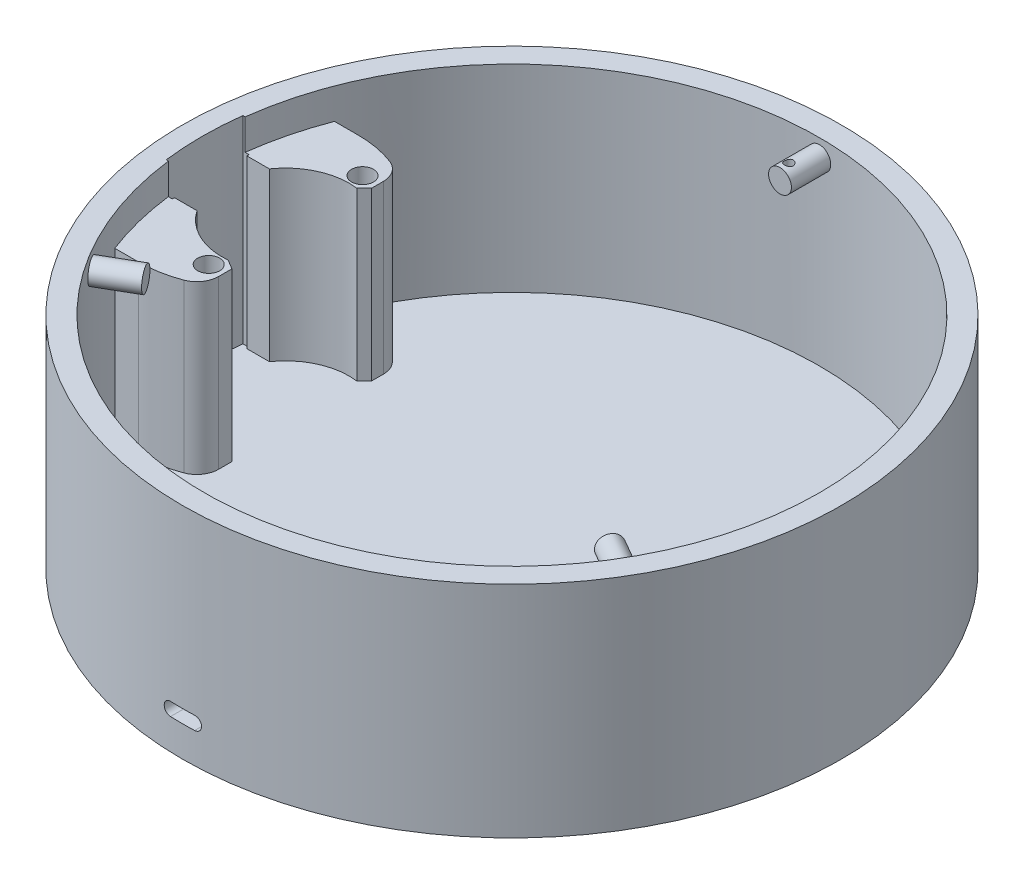
from build123d import *

# Parameters (mm, degrees)
SKETCH1_R               = 75
BOSS_EXTRUDE1_DEPTH     = 50
SHELL1_T                = -5
CUT_EXTRUDE1_REACH      = 177
CUT_EXTRUDE1_END_RADIUS = 70
BOSS_EXTRUDE2_DEPTH     = 10
CIRPATTERN1_COUNT       = 3
BOSS_EXTRUDE6_DEPTH     = 38
SKETCH13_R              = 2.5
CUT_EXTRUDE7_DEPTH      = 5
SKETCH14_R              = 2.5
CUT_EXTRUDE8_DEPTH      = 5
CUT_EXTRUDE9_START      = -38
CUT_EXTRUDE9_DEPTH      = 38
CHAMFER1_SIZE           = 2
CHAMFER1_SIZE_2         = 1.650424
FILLET1_R               = 5
CUT_EXTRUDE10_DEPTH     = 45
CUT_EXTRUDE11_REACH     = 123.861
SKETCH18_R              = 1


with BuildPart() as part:
    # Sketch1 → Boss-Extrude1 (new body)
    with BuildSketch(Plane(origin=(0, 0, 0), x_dir=(1, 0, 0), z_dir=(0, 1, 0))):
        with Locations(Location((0, 0, 0), (0, 0, 270))):
            Circle(SKETCH1_R)
    extrude(amount=BOSS_EXTRUDE1_DEPTH)

    # Shell1
    shell1_openings = [part.faces().sort_by_distance(p)[0] for p in [
        (0, 50, 0),
    ]]
    offset(amount=SHELL1_T, openings=shell1_openings, kind=Kind.INTERSECTION)

    # Cut-Extrude1: up to this cylinder (the profile starts outside it)
    cut_extrude1_end = Plane(origin=(0, 8.5, 0), z_dir=(0, -1, 0)) * Cylinder(CUT_EXTRUDE1_END_RADIUS, 495, mode=Mode.PRIVATE)
    # Sketch2 → Cut-Extrude1 (cut, up to the surface)
    with BuildSketch(Plane.XY.offset(75), mode=Mode.PRIVATE) as cut_extrude1_sk1:
        with BuildLine():
            Line((-2.75, 10), (2.75, 10))
            ThreePointArc((2.75, 10), (4.25, 8.5), (2.75, 7))
            Line((2.75, 7), (-2.75, 7))
            ThreePointArc((-2.75, 7), (-4.25, 8.5), (-2.75, 10))
        make_face()
    cut_extrude1_tool1 = extrude(cut_extrude1_sk1.sketch, amount=-CUT_EXTRUDE1_REACH, mode=Mode.PRIVATE) - cut_extrude1_end
    add(cut_extrude1_tool1.solids().sort_by_distance((0, 8.5, 75))[0], mode=Mode.SUBTRACT)

    # Sketch3 → Boss-Extrude2 (add)
    with BuildSketch(Plane.XY.offset(-71)):
        with BuildLine():
            ThreePointArc((0, 48.6), (-2.6, 46), (0, 43.4))
            Line((0, 43.4), (0, 48.6))
        make_face()
        with BuildLine():
            Line((0, 48.6), (0, 43.4))
            ThreePointArc((0, 43.4), (1.838478, 44.161522), (2.6, 46))
            ThreePointArc((2.6, 46), (1.838478, 47.838478), (0, 48.6))
        make_face()
    boss_extrude2 = extrude(amount=BOSS_EXTRUDE2_DEPTH)

    # CirPattern1: Boss-Extrude2 ×3 about axis
    cirpattern1_axis = Axis((0, 50, 0), (0, 1, 0))
    for i in range(1, CIRPATTERN1_COUNT):
        add(boss_extrude2.rotate(cirpattern1_axis, i * 360 / CIRPATTERN1_COUNT))

    # Sketch11 → Boss-Extrude6 (add)
    with BuildSketch(Plane(origin=(0, 5, 0), x_dir=(1, 0, 0), z_dir=(0, 1, 0))):
        with BuildLine():
            Line((-70.710678, 25), (-60, 25))
            ThreePointArc((-60, 25), (-35, 0), (-60, -25))
            Line((-60, -25), (-70.710678, -25))
            ThreePointArc((-70.710678, -25), (-75, 0), (-70.710678, 25))
        make_face()
    extrude(amount=BOSS_EXTRUDE6_DEPTH)

    # Sketch13 → Cut-Extrude7 (cut)
    with BuildSketch(Plane(origin=(0, 43, 0), x_dir=(1, 0, 0), z_dir=(0, 1, 0))):
        with Locations(Location((-51.5, 17.5, 0), (0, 0, 270))):
            Circle(SKETCH13_R)
        with Locations(Location((-51.5, -17.5, 0), (0, 0, 270))):
            Circle(SKETCH13_R)
    extrude(amount=-CUT_EXTRUDE7_DEPTH, mode=Mode.SUBTRACT)

    # Sketch14 → Cut-Extrude8 (cut)
    with BuildSketch(Plane(origin=(0, 43, 0), x_dir=(1, 0, 0), z_dir=(0, 1, 0))):
        with Locations(Location((-43.5, 0, 0), (0, 0, 270))):
            Circle(SKETCH14_R)
    extrude(amount=-CUT_EXTRUDE8_DEPTH, mode=Mode.SUBTRACT)

    # Sketch15 → Cut-Extrude9 (cut)
    with BuildSketch(Plane(origin=(0, 43, 0), x_dir=(1, 0, 0), z_dir=(0, 1, 0)).offset(CUT_EXTRUDE9_START)):
        with BuildLine():
            Line((-48, 14.071247), (-48, 21.931712))
            ThreePointArc((-48, 21.931712), (-35, 0), (-48, -21.931712))
            Line((-48, -21.931712), (-48, -14.071247))
            ThreePointArc((-48, -14.071247), (-56.627447, -13.563159), (-63.433377, -8.236778))
            Line((-63.433377, -8.236778), (-69.0626, -8.236778))
            Line((-69.0626, -8.236778), (-69.0626, 8.236778))
            Line((-69.0626, 8.236778), (-63.433377, 8.236778))
            ThreePointArc((-63.433377, 8.236778), (-56.627447, 13.563159), (-48, 14.071247))
        make_face()
    extrude(amount=CUT_EXTRUDE9_DEPTH, mode=Mode.SUBTRACT)

    # Chamfer1
    # the kernel refuses this chamfer: 2, 1.650424 mm, written as the material it takes off along each edge
    with BuildSketch(Plane(origin=(-48, 5, -14.071247), x_dir=(-0.9830032645487412, 0, -0.1835880766458365), z_dir=(0, 1, 0))) as chamfer1_piece_1:
        with BuildLine():
            Line((1.714396, 0), (CHAMFER1_SIZE * 0.183588076646, -CHAMFER1_SIZE * 0.983003264549))
            Line((CHAMFER1_SIZE * 0.183588076646, -CHAMFER1_SIZE * 0.983003264549), (0, 0))
            ThreePointArc((0, 0), (0.8799, -0.025342), (1.714396, 0))
        make_face()
    extrude(amount=43.143366, mode=Mode.SUBTRACT)
    with BuildSketch(Plane(origin=(-48, 5, 14.071247), x_dir=(0, 0, 1), z_dir=(0, 1, 0))) as chamfer1_piece_2:
        with BuildLine():
            Line((CHAMFER1_SIZE_2, 0), (0.364578, -2.137299))
            ThreePointArc((0.364578, -2.137299), (0.227384, -1.091857), (0, 0))
            Line((0, 0), (CHAMFER1_SIZE_2, 0))
        make_face()
    extrude(amount=43.573552, mode=Mode.SUBTRACT)

    # Fillet1
    fillet1_edges = [part.edges().sort_by_distance(p)[0] for p in [
        (-48, 24, -21.931712),
        (-48, 24, 21.931712),
    ]]
    fillet(fillet1_edges, radius=FILLET1_R)

    # Sketch16 → Cut-Extrude10 (cut)
    with BuildSketch(Plane(origin=(0, 50, 0), x_dir=(1, 0, 0), z_dir=(0, 1, 0))):
        with BuildLine():
            Line((-68.5626, -8.736778), (-69.956549, -8.736778))
            ThreePointArc((-69.956549, -8.736778), (-70.5, 0), (-69.956549, 8.736778))
            Line((-69.956549, 8.736778), (-68.5626, 8.736778))
            Line((-68.5626, 8.736778), (-68.5626, -8.736778))
        make_face()
    extrude(amount=-CUT_EXTRUDE10_DEPTH, mode=Mode.SUBTRACT)

    # Sketch18 → Cut-Extrude11 (cut, up to next)
    with BuildSketch(Plane(origin=(0, 60, 0), x_dir=(1, 0, 0), z_dir=(0, 1, 0)), mode=Mode.PRIVATE) as cut_extrude11_sk1:
        with Locations(Location((0, 63, 0), (0, 0, 270))):
            Circle(SKETCH18_R)
    cut_extrude11_tool1 = extrude(cut_extrude11_sk1.sketch, amount=-CUT_EXTRUDE11_REACH, mode=Mode.PRIVATE) & part.part
    add(cut_extrude11_tool1.solids().sort_by_distance((0, 60, -63))[0], mode=Mode.SUBTRACT)


solid = part.part
